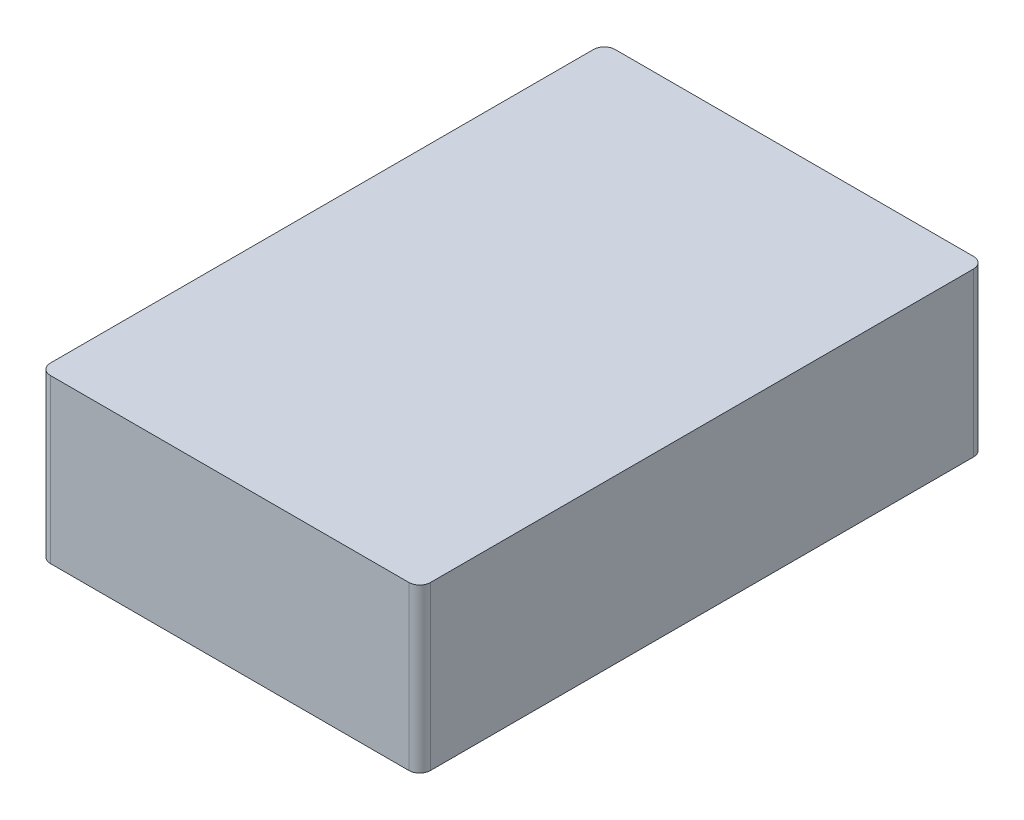
from build123d import *

# Parameters (mm, degrees)
SKETCH1_W           = 35
SKETCH1_H           = 52
BOSS_EXTRUDE1_DEPTH = 15
FILLET1_R           = 1


with BuildPart() as part:
    # Sketch1 → Boss-Extrude1 (new body)
    with BuildSketch(Plane(origin=(0, 0, 0), x_dir=(1, 0, 0), z_dir=(0, 1, 0))):
        Rectangle(SKETCH1_W, SKETCH1_H)
    extrude(amount=BOSS_EXTRUDE1_DEPTH)

    # Fillet1
    fillet1_edges = [part.edges().sort_by_distance(p)[0] for p in [
        (-17.5, 7.5, -26),
        (17.5, 7.5, -26),
        (17.5, 7.5, 26),
        (-17.5, 7.5, 26),
    ]]
    fillet(fillet1_edges, radius=FILLET1_R)


solid = part.part
